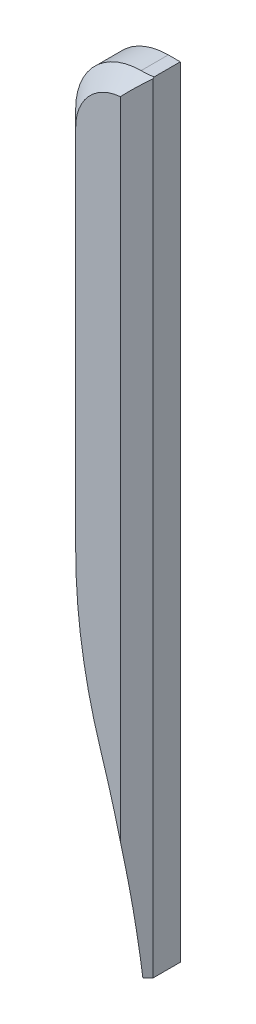
from build123d import *

# Parameters (mm, degrees)
EXTRUDE_1_DEPTH     = 4
SKETCH_2_W          = 6.166461301
SKETCH_2_H          = 14.966809979
CUT_EXTRUDE_1_DEPTH = 86.646256186
CHAMFER_3_SIZE      = 1.5


with BuildPart() as part:
    # Эскиз1 → Бобышка-Вытянуть1 (new body)
    with BuildSketch(Plane.XY):
        with BuildLine():
            Line((0, 0), (0, 85.257675306))
            Line((0, 85.257675306), (-1.1, 85.257675306))
            ThreePointArc((-1.1, 85.257675306), (-5.342640687, 83.500315993), (-7.1, 79.257675306))
            Line((-7.1, 79.257675306), (-7.1, 45.60252186))
            ThreePointArc((-7.1, 45.60252186), (-6.504790591, 37.910534687), (-4.733333333, 30.40168124))
            ThreePointArc((-4.733333333, 30.40168124), (-1.190418818, 15.383974346), (0, 0))
        make_face()
    extrude(amount=EXTRUDE_1_DEPTH)

    # Эскиз2 → Вырез-Вытянуть1 (cut, through all)
    with BuildSketch(Plane.XY.offset(4)):
        with Locations((-0.950413373, 6.187246753)):
            Rectangle(SKETCH_2_W, SKETCH_2_H)
    extrude(amount=-CUT_EXTRUDE_1_DEPTH, mode=Mode.SUBTRACT)

    # Фаска3
    chamfer_3_edges = [part.edges().sort_by_distance(p)[0] for p in [
        (0, 49.464163524, 4),
    ]]
    chamfer(chamfer_3_edges, length=CHAMFER_3_SIZE)

    # Фаска4
    # the kernel refuses this chamfer: 1.5 mm, written as the material it takes off along each edge
    with BuildSketch(Plane(origin=(-100, 0, 4), x_dir=(0.9526666666666831, 0.30401681240054956, 0), z_dir=(-0.30401681240054956, 0.9526666666666831, 0))) as chamfer_4_piece_1:
        with BuildLine():
            Line((99.681801948, 1.818198052), (101.818198052, -0.318198052))
            Line((101.818198052, -0.318198052), (101.818198052, -0.543198052))
            ThreePointArc((101.818198052, -0.543198052), (100.909099026, -0.225), (100, -0.225))
            Line((100, -0.225), (99.775, 0))
            ThreePointArc((99.775, 0), (99.775, 0.909099026), (99.456801948, 1.818198052))
            Line((99.456801948, 1.818198052), (99.681801948, 1.818198052))
        make_face()
    revolve(axis=Axis((-100, 0, 4), (0, 0, -1)), revolution_arc=10.406622552, mode=Mode.SUBTRACT)
    with BuildSketch(Plane(origin=(-1.1, 79.257675306, 4), x_dir=(0.6462526290472239, 0.7631235414069935, 0), z_dir=(0.7631235414069935, -0.6462526290472239, 0))) as chamfer_4_piece_2:
        with BuildLine():
            Line((6.318198052, -1.818198052), (4.181801948, 0.318198052))
            Line((4.181801948, 0.318198052), (4.181801948, 0.543198052))
            ThreePointArc((4.181801948, 0.543198052), (5.090900974, 0.225), (6, 0.225))
            Line((6, 0.225), (6.225, 0))
            ThreePointArc((6.225, 0), (6.225, -0.909099026), (6.543198052, -1.818198052))
            Line((6.543198052, -1.818198052), (6.318198052, -1.818198052))
        make_face()
    revolve(axis=Axis((-1.1, 79.257675306, 4), (0, 0, 1)), revolution_arc=130.259658386, mode=Mode.SUBTRACT)
    with BuildSketch(Plane(origin=(42.9, 45.60252186, 4), x_dir=(-1, 0, 0), z_dir=(0, 1, 0))) as chamfer_4_piece_3:
        with BuildLine():
            Line((48.181801948, 0.318198052), (50.318198052, -1.818198052))
            Line((50.318198052, -1.818198052), (50.543198052, -1.818198052))
            ThreePointArc((50.543198052, -1.818198052), (50.225, -0.909099026), (50.225, 0))
            Line((50.225, 0), (50, 0.225))
            ThreePointArc((50, 0.225), (49.090900974, 0.225), (48.181801948, 0.543198052))
            Line((48.181801948, 0.543198052), (48.181801948, 0.318198052))
        make_face()
    revolve(axis=Axis((42.9, 45.60252186, 4), (0, 0, 1)), revolution_arc=17.69902277, mode=Mode.SUBTRACT)
    with BuildSketch(Plane(origin=(-7.1, 79.257675306, 4), x_dir=(0.9850292351397438, 0, 0.17238737169529317), z_dir=(0, -1, 0))) as chamfer_4_piece_4:
        with BuildLine():
            Line((1.845831562, 0), (-0.626868767, -1.73612491))
            Line((-0.626868767, -1.73612491), (-0.848500345, -1.697337752))
            ThreePointArc((-0.848500345, -1.697337752), (-0.37834877, -0.856701959), (-0.221631578, 0.038787159))
            Line((-0.221631578, 0.038787159), (0.038787159, 0.221631578))
            ThreePointArc((0.038787159, 0.221631578), (0.934276277, 0.064914386), (1.88461872, 0.221631578))
            Line((1.88461872, 0.221631578), (1.845831562, 0))
        make_face()
    extrude(amount=33.655153446, mode=Mode.SUBTRACT)


solid = part.part
